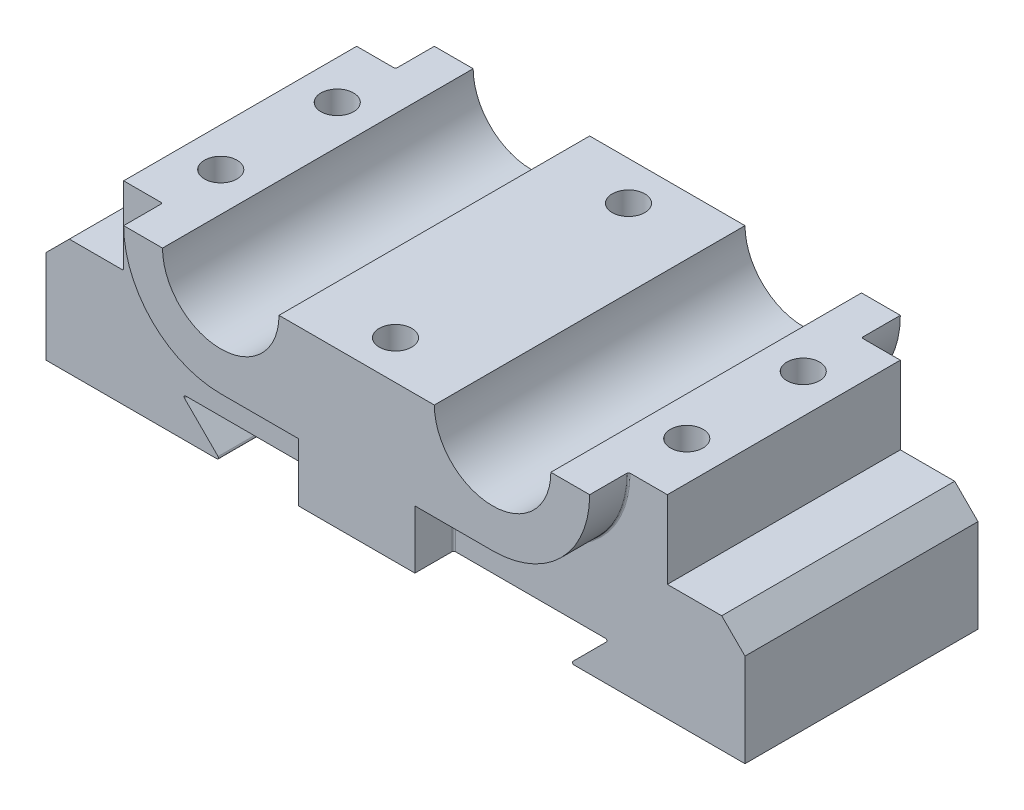
from build123d import *
from build123d.topology import SkipClean

# Parameters (mm, degrees)
EXTRUDE_1_DEPTH       = 20
EXTRUDE_1_DEPTH_BACK  = 20
EXTRUDE_2_DEPTH       = 15
EXTRUDE_2_DEPTH_BACK  = 15
HOLE_WIZARD_M51_D     = 4.2
HOLE_WIZARD_M51_DEPTH = 16
HOLE_WIZARD_M51_TIP   = 1.2618073
CHAMFER_1_SIZE        = 3
FILLET_1_R            = 0.2
FILLET_2_R            = 0.2
FILLET_3_R            = 0.2


with BuildPart() as part:
    # Эскиз1 → Бобышка-Вытянуть1 (new, two sides: drawn at the far end of the back side and taken through both)
    with BuildSketch(Plane.XY.offset(-EXTRUDE_1_DEPTH_BACK)):
        with BuildLine():
            Line((17.5, -12.5), (7.5, -12.5))
            Line((7.5, -12.5), (7.5, -20))
            Line((7.5, -20), (-7.5, -20))
            Line((-7.5, -20), (-7.5, -12.5))
            Line((-7.5, -12.5), (-17.5, -12.5))
            ThreePointArc((-17.5, -12.5), (-26.338834765, -8.838834765), (-30, 0))
            Line((-30, 0), (-25, 0))
            ThreePointArc((-25, 0), (-17.5, -7.5), (-10, 0))
            Line((-10, 0), (10, 0))
            ThreePointArc((10, 0), (17.5, -7.5), (25, 0))
            Line((25, 0), (30, 0))
            ThreePointArc((30, 0), (26.338834765, -8.838834765), (17.5, -12.5))
        make_face()
    extrude(amount=EXTRUDE_1_DEPTH + EXTRUDE_1_DEPTH_BACK)

    # Эскиз2 → Бобышка-Вытянуть2 (add, two sides: drawn at the far end of the back side and taken through both)
    with SkipClean():  # the faces are left unmerged after this step: merging them gives an invalid solid
        with BuildSketch(Plane.XY.offset(-EXTRUDE_2_DEPTH_BACK)):
            with BuildLine():
                Line((22.5, -25), (45, -25))
                Line((45, -25), (45, -10))
                Line((45, -10), (35, -10))
                Line((35, -10), (35, 0))
                Line((35, 0), (25, 0))
                ThreePointArc((25, 0), (17.5, -7.5), (10, 0))
                Line((10, 0), (-10, 0))
                ThreePointArc((-10, 0), (-17.5, -7.5), (-25, 0))
                Line((-25, 0), (-35, 0))
                Line((-35, 0), (-35, -10))
                Line((-35, -10), (-45, -10))
                Line((-45, -10), (-45, -25))
                Line((-45, -25), (-22.5, -25))
                Line((-22.5, -25), (-27.5, -20))
                Line((-27.5, -20), (27.5, -20))
                Line((27.5, -20), (22.5, -25))
            make_face()
        extrude(amount=EXTRUDE_2_DEPTH + EXTRUDE_2_DEPTH_BACK)
    add(part.part.scale(1), mode=Mode.REPLACE)  # the faces are merged on a copy

    # Отверстие обработанное метчиком M51
    with Locations(Plane(origin=(0, 0, 0), x_dir=(1, 0, 0), z_dir=(0, 1, 0))):
        with Locations((-30, 7.5), (-30, -7.5), (0, 15), (0, -15), (30, -7.5), (30, 7.5)):
            Hole(HOLE_WIZARD_M51_D / 2, depth=HOLE_WIZARD_M51_DEPTH)
            with Locations((0, 0, -(HOLE_WIZARD_M51_DEPTH + HOLE_WIZARD_M51_TIP / 2))):  # 118° drill point
                Cone(0, HOLE_WIZARD_M51_D / 2, HOLE_WIZARD_M51_TIP, mode=Mode.SUBTRACT)

    # Фаска1
    chamfer_1_edges = [part.edges().sort_by_distance(p)[0] for p in [
        (45, -10, 0),
        (-45, -10, 0),
    ]]
    chamfer(chamfer_1_edges, length=CHAMFER_1_SIZE)

    # Скругление1
    fillet_1_edges = [part.edges().sort_by_distance(p)[0] for p in [
        (22.5, -25, 0),
        (27.5, -20, 0),
        (-22.5, -25, 0),
        (-27.5, -20, 0),
    ]]
    fillet(fillet_1_edges, radius=FILLET_1_R)

    # Скругление2
    fillet_2_edges = [part.edges().sort_by_distance(p)[0] for p in [
        (-35, -10, 0),
    ]]
    fillet(fillet_2_edges, radius=FILLET_2_R)

    # Скругление3
    fillet_3_edges = [part.edges().sort_by_distance(p)[0] for p in [
        (12.5, -12.5, -15),
        (-12.5, -12.5, -15),
        (26.338834765, -8.838834765, 15),
        (-12.5, -12.5, 15),
        (7.5, -16.25, -15),
        (26.338834765, -8.838834765, -15),
        (-7.5, -16.25, -15),
        (-26.338834765, -8.838834765, -15),
        (12.5, -12.5, 15),
        (7.5, -16.25, 15),
        (-7.5, -16.25, 15),
        (-26.338834765, -8.838834765, 15),
    ]]
    fillet(fillet_3_edges, radius=FILLET_3_R)


solid = part.part
